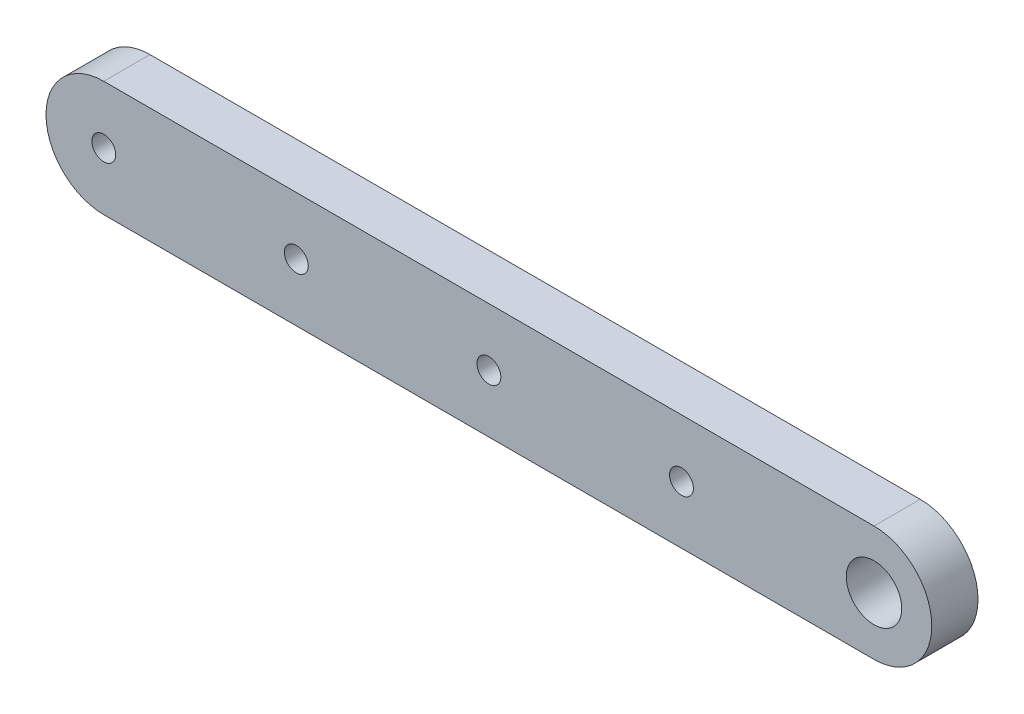
from build123d import *

# Parameters (mm, degrees)
BOSS_EXTRUDE1_DEPTH = 6
SKETCH2_R           = 1.55
CUT_EXTRUDE1_DEPTH  = 108.928216885
LPATTERN1_COUNT     = 4
LPATTERN1_PITCH     = 25
SKETCH3_R           = 3.6
CUT_EXTRUDE2_DEPTH  = 108.928216885


with BuildPart() as part:
    # Sketch1 → Boss-Extrude1 (new body)
    with BuildSketch(Plane.XY):
        with BuildLine():
            Line((100, 7.5), (0, 7.5))
            ThreePointArc((0, 7.5), (-7.5, 0), (0, -7.5))
            Line((0, -7.5), (100, -7.5))
            ThreePointArc((100, -7.5), (107.5, 0), (100, 7.5))
        make_face()
    extrude(amount=BOSS_EXTRUDE1_DEPTH)

    # Sketch2 → Cut-Extrude1 (cut, through all)
    with BuildSketch(Plane.XY.offset(6)):
        Circle(SKETCH2_R)
        with Locations((100, 0)):
            Circle(SKETCH2_R)
    cut_extrude1 = extrude(amount=-CUT_EXTRUDE1_DEPTH, mode=Mode.SUBTRACT)

    # LPattern1: Cut-Extrude1 ×4
    with Locations(*[(i * LPATTERN1_PITCH, 0, 0) for i in range(1, LPATTERN1_COUNT)]):
        add(cut_extrude1, mode=Mode.SUBTRACT)

    # Sketch3 → Cut-Extrude2 (cut, through all)
    with BuildSketch(Plane.XY.offset(6)):
        with Locations((100, 0)):
            Circle(SKETCH3_R)
    extrude(amount=-CUT_EXTRUDE2_DEPTH, mode=Mode.SUBTRACT)


solid = part.part
